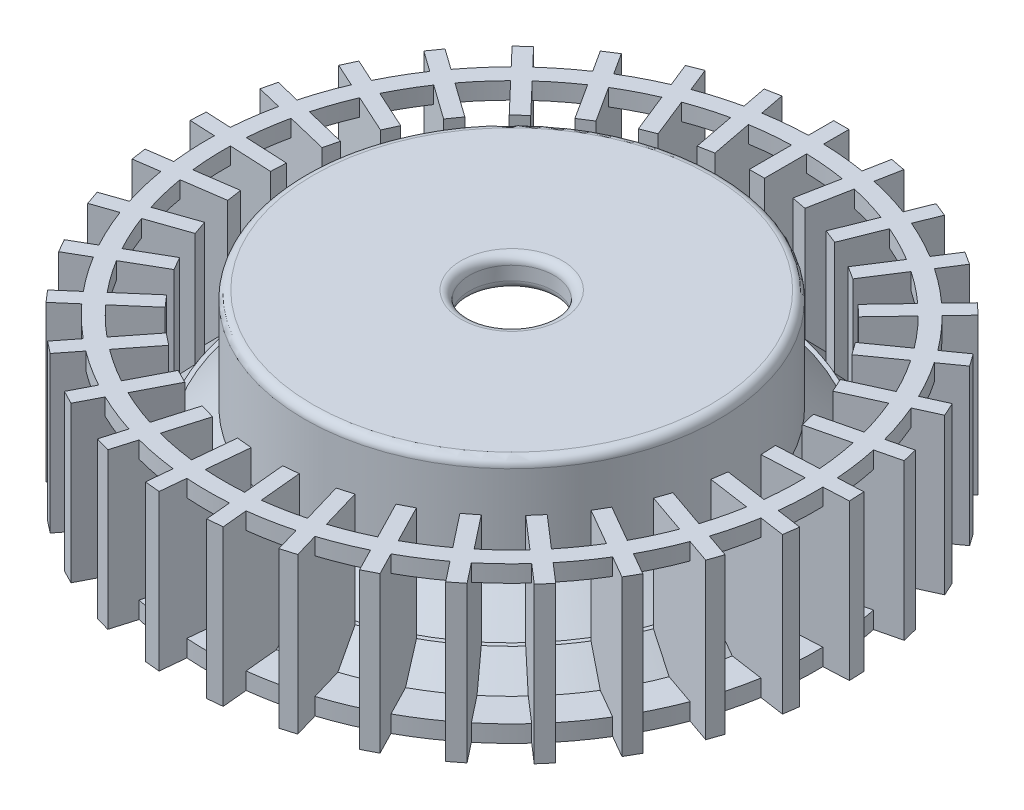
from build123d import *
from build123d.topology import SkipClean

# Parameters (mm, degrees)
SKETCH_1_R               = 18
EXTRUDE_1_DEPTH          = 1
SKETCH_2_R               = 16
EXTRUDE_2_DEPTH          = 1.5
CHAMFER_1_SIZE           = 1.5
SKETCH_3_R               = 12.25
EXTRUDE_3_DEPTH          = 8
FILLET_1_R               = 0.5
SKETCH_4_W               = 0.9
SKETCH_4_H               = 4.994807001
EXTRUDE_4_DEPTH          = 9.2
PATTERN_CIRCULAR_1_COUNT = 33
SKETCH_5_R               = 14.6
CUT_EXTRUDE_1_DEPTH      = 1.2
CHAMFER_2_SIZE           = 0.7
SKETCH_6_R               = 11.4
CUT_EXTRUDE_2_DEPTH      = 8.5
BOSS_EXTRUDE1_START      = -1
SKETCH1_R                = 18
SKETCH1_R_2              = 17
BOSS_EXTRUDE1_DEPTH      = 1
BOSS_EXTRUDE3_REACH      = 31.096
SKETCH3_R                = 11.4
SKETCH3_R_2              = 11.2
BOSS_EXTRUDE4_START      = 1
SKETCH5_R                = 11.2
BOSS_EXTRUDE4_DEPTH      = 1
FILLET1_R                = 0.5
SKETCH6_R                = 2.5
CUT_EXTRUDE1_DEPTH       = 30.501167958
FILLET3_R                = 0.5
SKETCH10_R               = 14.6
CUT_EXTRUDE4_DEPTH       = 0.5
CHAMFER1_SIZE            = 1
FILLET4_R                = 0.001
SKETCH15_R               = 14.495292893
SKETCH15_R_2             = 12.25
BOSS_EXTRUDE6_DEPTH      = 0.5
CHAMFER3_SIZE            = 1.5
CHAMFER4_SIZE            = 2.4


with BuildPart() as part:
    # Эскиз1 → Бобышка-Вытянуть1 (new body)
    with BuildSketch(Plane(origin=(0, 0, 0), x_dir=(1, 0, 0), z_dir=(0, 1, 0))):
        with Locations(Location((0, 0, 0), (0, 0, 270))):
            Circle(SKETCH_1_R)
    extrude(amount=EXTRUDE_1_DEPTH)

    # Эскиз2 → Бобышка-Вытянуть2 (add)
    with BuildSketch(Plane(origin=(0, 1, 0), x_dir=(1, 0, 0), z_dir=(0, 1, 0))):
        with Locations(Location((0, 0, 0), (0, 0, 270))):
            Circle(SKETCH_2_R)
    extrude(amount=EXTRUDE_2_DEPTH)

    # Фаска1
    chamfer_1_edges = [part.edges().sort_by_distance(p)[0] for p in [
        (0, 2.5, -16),
    ]]
    chamfer(chamfer_1_edges, length=CHAMFER_1_SIZE - 0.0001)  # a hair under: the kernel refuses the full size

    # Эскиз3 → Бобышка-Вытянуть3 (add)
    with BuildSketch(Plane(origin=(0, 2.5, 0), x_dir=(1, 0, 0), z_dir=(0, 1, 0))):
        with Locations(Location((0, 0, 0), (0, 0, 270))):
            Circle(SKETCH_3_R)
    extrude(amount=EXTRUDE_3_DEPTH)

    # Скругление1
    fillet_1_edges = [part.edges().sort_by_distance(p)[0] for p in [
        (0, 10.5, -12.25),
    ]]
    fillet(fillet_1_edges, radius=FILLET_1_R)

    # Эскиз4 → Бобышка-Вытянуть4 (add)
    with BuildSketch(Plane(origin=(0, 0, 0), x_dir=(1, 0, 0), z_dir=(0, 1, 0))):
        with Locations((0, 16.997403501)):
            Rectangle(SKETCH_4_W, SKETCH_4_H)
    extrude_4 = extrude(amount=EXTRUDE_4_DEPTH)

    # Круговой массив1: Бобышка-Вытянуть4 ×33 about axis
    pattern_circular_1_axis = Axis((0, 0, 0), (0, 1, 0))
    for i in range(1, PATTERN_CIRCULAR_1_COUNT):
        add(extrude_4.rotate(pattern_circular_1_axis, i * 360 / PATTERN_CIRCULAR_1_COUNT))

    # Эскиз5 → Вырез-Вытянуть1 (cut)
    with BuildSketch(Plane.XZ):
        with Locations(Location((0, 0, 0), (0, 0, 270))):
            Circle(SKETCH_5_R)
    extrude(amount=-CUT_EXTRUDE_1_DEPTH, mode=Mode.SUBTRACT)

    # Фаска2
    chamfer_2_edges = [part.edges().sort_by_distance(p)[0] for p in [
        (0, 0, 14.6),
    ]]
    chamfer(chamfer_2_edges, length=CHAMFER_2_SIZE)

    # Эскиз6 → Вырез-Вытянуть2 (cut)
    with BuildSketch(Plane.XZ.offset(-1.2)):
        with Locations(Location((0, 0, 0), (0, 0, 270))):
            Circle(SKETCH_6_R)
    extrude(amount=-CUT_EXTRUDE_2_DEPTH, mode=Mode.SUBTRACT)

    # Sketch1 → Boss-Extrude1 (add)
    with BuildSketch(Plane(origin=(0, 9.2, 0), x_dir=(1, 0, 0), z_dir=(0, 1, 0)).offset(BOSS_EXTRUDE1_START)):
        Circle(SKETCH1_R)
        Circle(SKETCH1_R_2, mode=Mode.SUBTRACT)
    extrude(amount=BOSS_EXTRUDE1_DEPTH)

    # Sketch3 → Boss-Extrude3 (add, up to next)
    with BuildSketch(Plane.XZ.offset(-1.2), mode=Mode.PRIVATE) as boss_extrude3_sk1:
        Circle(SKETCH3_R)
        with Locations(Location((0, 0, 0), (0, 0, 270))):
            Circle(SKETCH3_R_2, mode=Mode.SUBTRACT)
    boss_extrude3_tool1 = extrude(boss_extrude3_sk1.sketch, amount=-BOSS_EXTRUDE3_REACH, mode=Mode.PRIVATE) - part.part
    add(boss_extrude3_tool1.solids().sort_by_distance((-11.367756, 1.2, 0))[0])

    # Sketch5 → Boss-Extrude4 (add)
    with BuildSketch(Plane.XZ.offset(-9.7).offset(BOSS_EXTRUDE4_START)):
        with Locations(Location((0, 0, 0), (0, 0, 270))):
            Circle(SKETCH5_R)
    extrude(amount=-BOSS_EXTRUDE4_DEPTH)

    # Fillet1
    fillet1_edges = [part.edges().sort_by_distance(p)[0] for p in [
        (0, 8.7, 11.2),
    ]]
    fillet(fillet1_edges, radius=FILLET1_R)

    # Sketch6 → Cut-Extrude1 (cut, through all)
    with BuildSketch(Plane(origin=(0, 10.5, 0), x_dir=(1, 0, 0), z_dir=(0, 1, 0))):
        with Locations(Location((0, 0, 0), (0, 0, 270))):
            Circle(SKETCH6_R)
    extrude(amount=-CUT_EXTRUDE1_DEPTH, mode=Mode.SUBTRACT)

    # Fillet3
    fillet3_edges = [part.edges().sort_by_distance(p)[0] for p in [
        (0, 8.7, -2.5),
        (0, 10.5, -2.5),
    ]]
    fillet(fillet3_edges, radius=FILLET3_R)

    # Sketch10 → Cut-Extrude4 (cut)
    with BuildSketch(Plane.XZ.offset(-1.2)):
        with Locations(Location((0, 0, 0), (0, 0, 270))):
            Circle(SKETCH10_R)
    extrude(amount=-CUT_EXTRUDE4_DEPTH, mode=Mode.SUBTRACT)

    # Chamfer1
    chamfer1_edges = [part.edges().sort_by_distance(p)[0] for p in [
        (0, 1.7, 14.6),
    ]]
    chamfer(chamfer1_edges, length=CHAMFER1_SIZE - 0.0001)  # a hair under: the kernel refuses the full size

    # Fillet4
    fillet4_edges = [part.edges().sort_by_distance(p)[0] for p in [
        (-10.958444403, 2.5, -9.495546128),
        (-12.557454957, 2.5, -7.25005),
        (-13.702606371, 2.5, -4.742518175),
        (-14.352509889, 2.5, -2.063579386),
        (-14.483676305, 2.5, 0.689942538),
        (-14.091364922, 2.5, 3.418528141),
        (-13.189754896, 2.5, 6.02355923),
        (-11.811432762, 2.5, 8.410883194),
        (-10.006214674, 2.5, 10.494215926),
        (-7.839345917, 2.5, 12.198260351),
        (-5.389142773, 2.5, 13.461427866),
        (-2.744161968, 2.5, 14.238064303),
        (0, 2.5, 14.5001),
        (2.744161968, 2.5, 14.238064303),
        (5.389142773, 2.5, 13.461427866),
        (-4.085150247, 2.5, -13.912744067),
        (7.839345917, 2.5, 12.198260351),
        (10.006214674, 2.5, 10.494215926),
        (11.811432762, 2.5, 8.410883194),
        (13.189754896, 2.5, 6.02355923),
        (14.091364922, 2.5, 3.418528141),
        (14.483676305, 2.5, 0.689942538),
        (14.352509889, 2.5, -2.063579386),
        (13.702606371, 2.5, -4.742518175),
        (12.557454957, 2.5, -7.25005),
        (10.958444403, 2.5, -9.495546128),
        (-6.644330388, 2.5, -12.888202889),
        (8.963367116, 2.5, -11.397848479),
        (6.644330388, 2.5, -12.888202889),
        (4.085150247, 2.5, -13.912744067),
        (1.378322134, 2.5, -14.434442425),
        (-8.963367116, 2.5, -11.397848479),
        (-1.378322134, 2.5, -14.434442425),
    ]]
    fillet(fillet4_edges, radius=FILLET4_R)

    # Sketch15 → Boss-Extrude6 (add)
    with BuildSketch(Plane(origin=(0, 2.5, 0), x_dir=(1, 0, 0), z_dir=(0, 1, 0))):
        with Locations(Location((0, 0, 0), (0, 0, 270))):
            Circle(SKETCH15_R)
        with Locations(Location((0, 0, 0), (0, 0, 270))):
            Circle(SKETCH15_R_2, mode=Mode.SUBTRACT)
    extrude(amount=BOSS_EXTRUDE6_DEPTH)

    # Chamfer3
    chamfer3_edges = [part.edges().sort_by_distance(p)[0] for p in [
        (0, 3, -12.25),
    ]]
    chamfer(chamfer3_edges, length=CHAMFER3_SIZE)

    # Chamfer4
    chamfer4_edges = [part.edges().sort_by_distance(p)[0] for p in [
        (0, 1.7, 11.2),
    ]]
    chamfer(chamfer4_edges, length=CHAMFER4_SIZE)

    # Sketch16 → Cut-Revolve1 (revolve, cut)
    with SkipClean():  # the faces are left unmerged after this step: merging them gives an invalid solid
        with BuildSketch(Plane.XY, mode=Mode.PRIVATE) as cut_revolve1_sk:
            Polygon((13.75, 3), (14.25, 2.5), (14.495292893, 2.5), (14.495292893, 3), align=None)
        revolve(cut_revolve1_sk.sketch.rotate(Axis((0, 8.7, 0), (0, 1, 0)), 90), axis=Axis((0, 8.7, 0), (0, 1, 0)), mode=Mode.SUBTRACT)


solid = part.part
